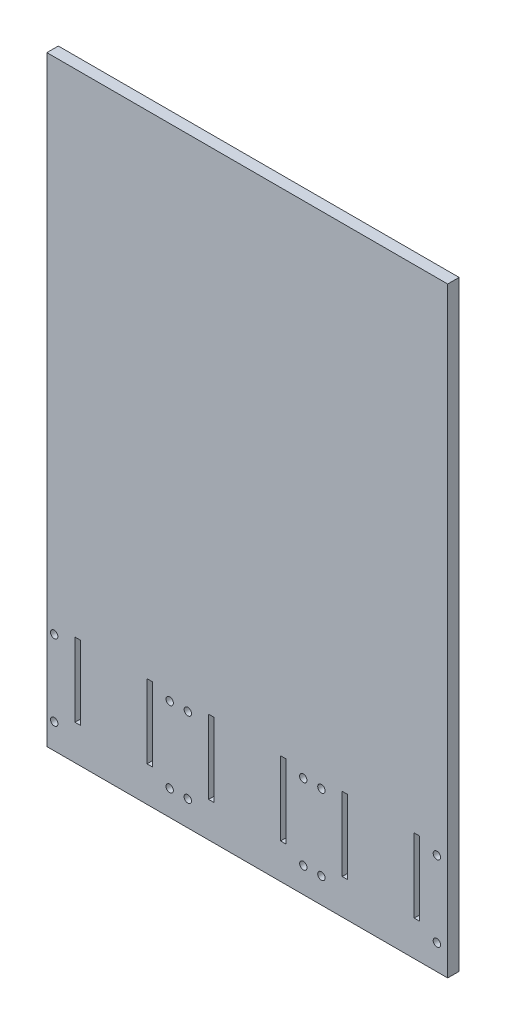
from build123d import *

# Parameters (mm, degrees)
SKETCH1_W           = 222.6
SKETCH1_H           = 333.796179707
SKETCH1_W_2         = 3
SKETCH1_H_2         = 41
BOSS_EXTRUDE1_DEPTH = 6.35
SKETCH2_R           = 2.05
CUT_EXTRUDE1_DEPTH  = 10


with BuildPart() as part:
    # Sketch1 → Boss-Extrude1 (new body)
    with BuildSketch(Plane.XY):
        with Locations((0, 55.357254345)):
            Rectangle(SKETCH1_W, SKETCH1_H)
        with Locations((-94.2, -71.540835509)):
            Rectangle(SKETCH1_W_2, SKETCH1_H_2, mode=Mode.SUBTRACT)
        with Locations((-54.2, -71.540835509)):
            Rectangle(SKETCH1_W_2, SKETCH1_H_2, mode=Mode.SUBTRACT)
        with Locations((20, -71.540835509)):
            Rectangle(SKETCH1_W_2, SKETCH1_H_2, mode=Mode.SUBTRACT)
        with Locations((-20, -71.540835509)):
            Rectangle(SKETCH1_W_2, SKETCH1_H_2, mode=Mode.SUBTRACT)
        with Locations((94.2, -71.540835509)):
            Rectangle(SKETCH1_W_2, SKETCH1_H_2, mode=Mode.SUBTRACT)
        with Locations((54.2, -71.540835509)):
            Rectangle(SKETCH1_W_2, SKETCH1_H_2, mode=Mode.SUBTRACT)
    extrude(amount=BOSS_EXTRUDE1_DEPTH)

    # Sketch2 → Cut-Extrude1 (cut)
    with BuildSketch(Plane(origin=(0, 0, 0), x_dir=(-1, 0, 0), z_dir=(0, 0, -1))):
        with Locations((-105.3, -97.540835509)):
            Circle(SKETCH2_R)
        with Locations((-105.3, -55.540835509)):
            Circle(SKETCH2_R)
        with Locations((-41.1662452, -97.540835509)):
            Circle(SKETCH2_R)
        with Locations((-41.1662452, -55.540835509)):
            Circle(SKETCH2_R)
        with Locations((-31.1, -97.540835509)):
            Circle(SKETCH2_R)
        with Locations((-31.1, -55.540835509)):
            Circle(SKETCH2_R)
        with Locations((33.0337548, -97.540835509)):
            Circle(SKETCH2_R)
        with Locations((33.0337548, -55.540835509)):
            Circle(SKETCH2_R)
        with Locations((43.1, -97.540835509)):
            Circle(SKETCH2_R)
        with Locations((43.1, -55.540835509)):
            Circle(SKETCH2_R)
        with Locations((107.2337548, -97.540835509)):
            Circle(SKETCH2_R)
        with Locations((107.2337548, -55.540835509)):
            Circle(SKETCH2_R)
    extrude(amount=-CUT_EXTRUDE1_DEPTH, mode=Mode.SUBTRACT)


solid = part.part
